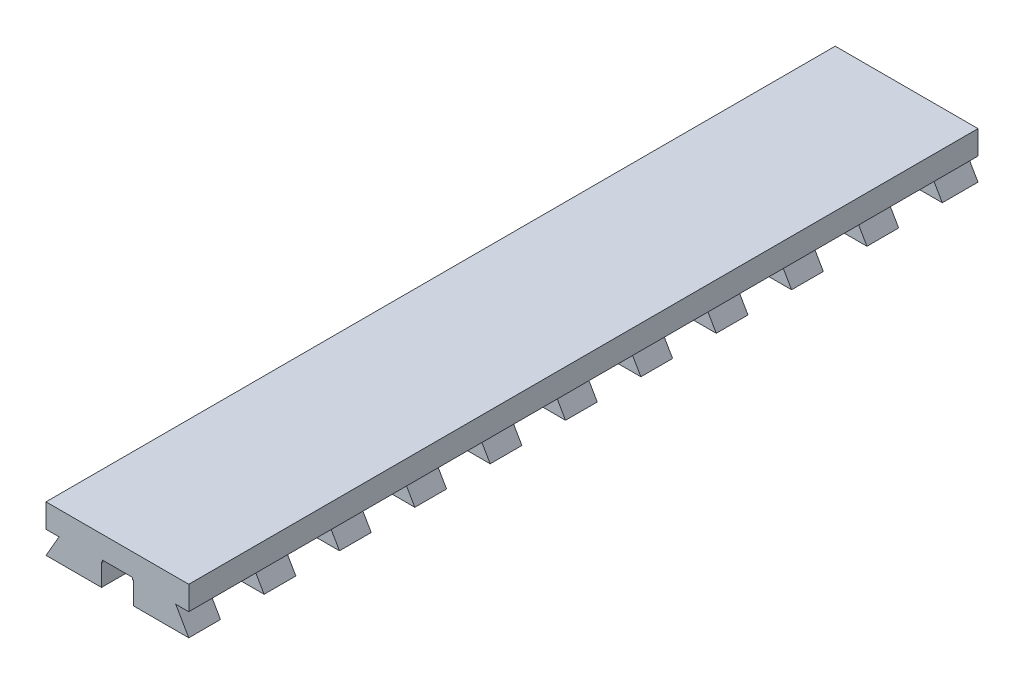
from build123d import *

# Parameters (mm, degrees)
BOSS_EXTRUDE1_DEPTH     = 49.75
CUT_EXTRUDE1_DEPTH      = 54.228610728
CUT_EXTRUDE1_DEPTH_BACK = 54.228610728
SKETCH2_W               = 5.5
SKETCH2_H               = 5.5


with BuildPart() as part:
    # Sketch1 → Boss-Extrude1 (new, symmetric)
    with BuildSketch(Plane.XY):
        Polygon((-9, 0), (9, 0), (9, -3), (7.354551733, -3), (9, -5.85), (2, -5.85), (2, -3.052391221), (1.9, -3.052391221), (1.9, -2.8), (-1.9, -2.8), (-1.9, -3.052391221), (-2, -3.052391221), (-2, -5.85), (-9, -5.85), (-7.354551733, -3), (-9, -3), align=None)
    extrude(amount=BOSS_EXTRUDE1_DEPTH, both=True)

    # Sketch2 → Cut-Extrude1 (cut, two sides: drawn at the far end of the back side and taken through both)
    with BuildSketch(Plane(origin=(9, 0, 0), x_dir=(0, 0, -1), z_dir=(1, 0, 0)).offset(-CUT_EXTRUDE1_DEPTH_BACK)):
        with Locations((-43, -5.75)):
            Rectangle(SKETCH2_W, SKETCH2_H)
        with Locations((-33.5, -5.75)):
            Rectangle(SKETCH2_W, SKETCH2_H)
        with Locations((-24, -5.75)):
            Rectangle(SKETCH2_W, SKETCH2_H)
        with Locations((-14.5, -5.75)):
            Rectangle(SKETCH2_W, SKETCH2_H)
        with Locations((-5, -5.75)):
            Rectangle(SKETCH2_W, SKETCH2_H)
        with Locations((4.5, -5.75)):
            Rectangle(SKETCH2_W, SKETCH2_H)
        with Locations((14, -5.75)):
            Rectangle(SKETCH2_W, SKETCH2_H)
        with Locations((23.5, -5.75)):
            Rectangle(SKETCH2_W, SKETCH2_H)
        with Locations((33, -5.75)):
            Rectangle(SKETCH2_W, SKETCH2_H)
        with Locations((42.5, -5.75)):
            Rectangle(SKETCH2_W, SKETCH2_H)
    extrude(amount=CUT_EXTRUDE1_DEPTH + CUT_EXTRUDE1_DEPTH_BACK, mode=Mode.SUBTRACT)


solid = part.part
